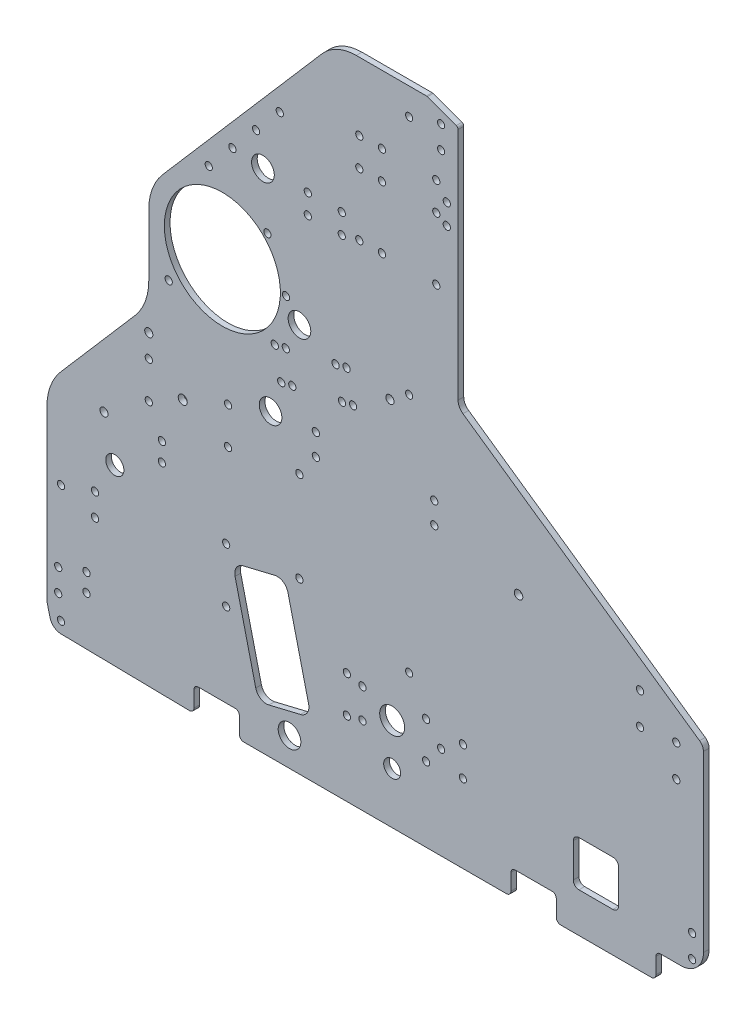
from build123d import *

# Parameters (mm, degrees)
SKETCH1_R           = 2.032
SKETCH1_R_2         = 5.08
SKETCH1_R_3         = 2.54
SKETCH1_R_4         = 6.35
SKETCH1_R_5         = 2
BOSS_EXTRUDE1_DEPTH = 3.175
FILLET1_R           = 2.286
FILLET2_R           = 6.35
SKETCH2_R           = 2.032
CUT_EXTRUDE1_DEPTH  = 505.524983177
FILLET3_R           = 1.5875
SKETCH3_R           = 6.35
SKETCH3_R_2         = 2.032
SKETCH3_R_3         = 2.286
CUT_EXTRUDE2_DEPTH  = 505.524983177
SKETCH4_R           = 2.032
SKETCH4_R_2         = 6.985
SKETCH4_R_3         = 4.7625
CUT_EXTRUDE3_DEPTH  = 505.524983177
SKETCH5_W           = 29.448186139
SKETCH5_H           = 14.946422423
SKETCH5_R           = 32.54375
SKETCH5_R_2         = 6.35
SKETCH5_R_3         = 2.39
CUT_EXTRUDE5_DEPTH  = 505.524983177
FILLET4_R           = 31.75
CUT_EXTRUDE6_DEPTH  = 505.524983177
FILLET5_R           = 25.4
SKETCH8_R           = 2.032000002
SKETCH8_R_2         = 2.031999999
SKETCH8_R_3         = 2.031999998
CUT_EXTRUDE7_DEPTH  = 505.524983177
SKETCH10_R          = 2.031999996
CUT_EXTRUDE8_DEPTH  = 505.524983177
SKETCH11_RX         = 2.032
SKETCH11_RY         = 2.031999502
CUT_EXTRUDE9_DEPTH  = 505.524983177
SKETCH12_R          = 2.032
CUT_EXTRUDE10_DEPTH = 505.524983319
SKETCH14_R          = 6.375981846
CUT_EXTRUDE11_DEPTH = 505.524983319
SKETCH15_R          = 2.286
CUT_EXTRUDE12_DEPTH = 505.524983319
FILLET6_R           = 12.7
FILLET7_R           = 5.08
FILLET8_R           = 2.54


with BuildPart() as part:
    # Sketch1 → Boss-Extrude1 (new body)
    with BuildSketch(Plane.XY):
        with BuildLine():
            Line((7.829508682, -19.049081656), (82.55, -20.32))
            Line((82.55, -20.32), (82.55, -6.35))
            Line((82.55, -6.35), (107.95, -6.35))
            Line((107.95, -6.35), (107.95, -20.32))
            Line((107.95, -20.32), (260.35, -20.32))
            Line((260.35, -20.32), (260.35, -6.35))
            Line((260.35, -6.35), (285.75, -6.35))
            Line((285.75, -6.35), (285.75, -20.32))
            Line((285.75, -20.32), (368.3, -20.32))
            Line((368.3, -20.32), (368.3, 106.68))
            Line((368.3, 106.68), (230.66375, 202.565))
            Line((230.66375, 202.565), (230.66375, 338.455))
            Line((230.66375, 338.455), (213.19998, 344.805))
            Line((213.19998, 344.805), (203.2, 344.805))
            Line((203.2, 344.805), (161.925, 344.805))
            Line((161.925, 344.805), (52.720122664, 218.469945827))
            ThreePointArc((52.720122664, 218.469945827), (52.803835479, 218.142145922), (52.832, 217.805))
            ThreePointArc((52.832, 217.805), (52.095493096, 216.239521914), (50.419872403, 215.808871996))
            Line((50.419872403, 215.808871996), (0, 157.48))
            Line((0, 157.48), (0, 0))
            Line((0, 0), (0, -6.35))
            ThreePointArc((0, -6.35), (0.047577015, -7.125863724), (0.189595124, -7.890101219))
            Line((0.189595124, -7.890101219), (1.777095124, -14.240101219))
            ThreePointArc((1.777095124, -14.240101219), (3.987212552, -17.671692778), (7.829508682, -19.049081656))
        make_face()
        with Locations((7.9375, -12.7)):
            Circle(SKETCH1_R, mode=Mode.SUBTRACT)
        with Locations((6.35, 0)):
            Circle(SKETCH1_R, mode=Mode.SUBTRACT)
        with Locations((6.35, 12.7)):
            Circle(SKETCH1_R, mode=Mode.SUBTRACT)
        with Locations((38.1, 78.105)):
            Circle(SKETCH1_R_2, mode=Mode.SUBTRACT)
        with Locations((57.15, 118.58625)):
            Circle(SKETCH1_R, mode=Mode.SUBTRACT)
        with Locations((57.15, 139.22375)):
            Circle(SKETCH1_R, mode=Mode.SUBTRACT)
        with Locations((76.2, 128.905)):
            Circle(SKETCH1_R_3, mode=Mode.SUBTRACT)
        with Locations((101.6, 118.58625)):
            Circle(SKETCH1_R, mode=Mode.SUBTRACT)
        with Locations((101.6, 139.22375)):
            Circle(SKETCH1_R, mode=Mode.SUBTRACT)
        with Locations((125.468192568, 147.91106164)):
            Circle(SKETCH1_R_4, mode=Mode.SUBTRACT)
        with Locations((203.2, 59.805)):
            Circle(SKETCH1_R_5, mode=Mode.SUBTRACT)
        with Locations((361.95, 0)):
            Circle(SKETCH1_R, mode=Mode.SUBTRACT)
        with Locations((361.95, 12.7)):
            Circle(SKETCH1_R, mode=Mode.SUBTRACT)
        with Locations((353.06, 82.955052336)):
            Circle(SKETCH1_R, mode=Mode.SUBTRACT)
        with Locations((332.74, 98.195052336)):
            Circle(SKETCH1_R, mode=Mode.SUBTRACT)
        with Locations((332.74, 115.975052336)):
            Circle(SKETCH1_R, mode=Mode.SUBTRACT)
        with Locations((353.06, 100.735052336)):
            Circle(SKETCH1_R, mode=Mode.SUBTRACT)
        with Locations((68.326, 182.923674932)):
            Circle(SKETCH1_R, mode=Mode.SUBTRACT)
        with Locations((76.2, 217.805)):
            Circle(SKETCH1_R, mode=Mode.SUBTRACT)
        with Locations((90.779500502, 249.682)):
            Circle(SKETCH1_R, mode=Mode.SUBTRACT)
        with Locations((104.067838673, 265.054783374)):
            Circle(SKETCH1_R, mode=Mode.SUBTRACT)
        with Locations((117.356176844, 280.427566748)):
            Circle(SKETCH1_R, mode=Mode.SUBTRACT)
        with Locations((130.644515014, 295.800350122)):
            Circle(SKETCH1_R, mode=Mode.SUBTRACT)
        with Locations((203.2, 194.805)):
            Circle(SKETCH1_R_5, mode=Mode.SUBTRACT)
        with Locations((224.31375, 287.401)):
            Circle(SKETCH1_R, mode=Mode.SUBTRACT)
        with Locations((224.31375, 298.831)):
            Circle(SKETCH1_R, mode=Mode.SUBTRACT)
        with Locations((203.2, 329.805)):
            Circle(SKETCH1_R_5, mode=Mode.SUBTRACT)
        with Locations((221.138115, 322.58)):
            Circle(SKETCH1_R_5, mode=Mode.SUBTRACT)
        with Locations((221.138115, 335.28)):
            Circle(SKETCH1_R_5, mode=Mode.SUBTRACT)
    extrude(amount=BOSS_EXTRUDE1_DEPTH)

    # Fillet1
    fillet1_edges = [part.edges().sort_by_distance(p)[0] for p in [
        (285.75, -6.35, 1.5875),
        (107.95, -6.35, 1.5875),
        (260.35, -6.35, 1.5875),
        (82.55, -6.35, 1.5875),
    ]]
    fillet(fillet1_edges, radius=FILLET1_R)

    # Fillet2
    fillet2_edges = [part.edges().sort_by_distance(p)[0] for p in [
        (230.66375, 202.565, 1.5875),
    ]]
    fillet(fillet2_edges, radius=FILLET2_R)

    # Sketch2 → Cut-Extrude1 (cut, through all)
    with BuildSketch(Plane(origin=(0, 0, 0), x_dir=(-1, 0, 0), z_dir=(0, 0, -1))):
        with Locations((-100.552770272, 71.086035298)):
            Circle(SKETCH2_R)
        with Locations((-100.552770272, 40.606035298)):
            Circle(SKETCH2_R)
        with Locations((-22.225, 18.202541089)):
            Circle(SKETCH2_R)
        with Locations((-22.225, 8.042541089)):
            Circle(SKETCH2_R)
    extrude(amount=-CUT_EXTRUDE1_DEPTH, mode=Mode.SUBTRACT)

    # Fillet3
    fillet3_edges = [part.edges().sort_by_distance(p)[0] for p in [
        (230.66375, 338.455, 1.5875),
        (213.19998, 344.805, 1.5875),
    ]]
    fillet(fillet3_edges, radius=FILLET3_R)

    # Sketch3 → Cut-Extrude2 (cut, through all)
    with BuildSketch(Plane.XY.offset(3.175)):
        with BuildLine():
            Line((127.789350211, 69.359774106), (110.090750339, 65.117184968))
            ThreePointArc((110.090750339, 65.117184968), (106.287939856, 62.356288953), (105.55119507, 57.715047577))
            Line((105.55119507, 57.715047577), (117.160037875, 9.287010566))
            ThreePointArc((117.160037875, 9.287010566), (119.92093389, 5.484200083), (124.562175266, 4.747455297))
            Line((124.562175266, 4.747455297), (142.260775137, 8.990044434))
            ThreePointArc((142.260775137, 8.990044434), (146.063585621, 11.75094045), (146.800330407, 16.392181825))
            Line((146.800330407, 16.392181825), (135.191487602, 64.820218836))
            ThreePointArc((135.191487602, 64.820218836), (132.430591586, 68.62302932), (127.789350211, 69.359774106))
        make_face()
        with Locations((136.094563167, -4.324155877)):
            Circle(SKETCH3_R)
        with Locations((26.987500002, 46.953113935)):
            Circle(SKETCH3_R_2)
        with Locations((26.987500002, 59.653113935)):
            Circle(SKETCH3_R_2)
        with Locations((7.937500002, 53.303113935)):
            Circle(SKETCH3_R_2)
        with Locations((32.030600738, 100.810868776)):
            Circle(SKETCH3_R_3)
        with Locations((64.525942114, 102.94048958)):
            Circle(SKETCH3_R_2)
        with Locations((64.525942114, 92.525786339)):
            Circle(SKETCH3_R_2)
        with Locations((134.14375, 208.228121768)):
            Circle(SKETCH3_R_2)
        with Locations((123.681970341, 233.485092108)):
            Circle(SKETCH3_R_2)
    extrude(amount=-CUT_EXTRUDE2_DEPTH, mode=Mode.SUBTRACT)

    # Sketch4 → Cut-Extrude3 (cut, through all)
    with BuildSketch(Plane.XY.offset(3.175)):
        with Locations((168.275, 42.06875)):
            Circle(SKETCH4_R)
        with Locations((212.725, 42.06875)):
            Circle(SKETCH4_R)
        with Locations((212.725, 21.43125)):
            Circle(SKETCH4_R)
        with Locations((168.275, 21.43125)):
            Circle(SKETCH4_R)
        with Locations((193.675, 31.75)):
            Circle(SKETCH4_R_2)
        with Locations((177.00498, 40.0431)):
            Circle(SKETCH4_R)
        with Locations((177.00498, 23.4569)):
            Circle(SKETCH4_R)
        with Locations((193.675, 8.466666658)):
            Circle(SKETCH4_R_3)
        with Locations((221.138115, 31.75)):
            Circle(SKETCH4_R)
        with Locations((233.36123, 23.4569)):
            Circle(SKETCH4_R)
        with Locations((233.36123, 40.0431)):
            Circle(SKETCH4_R)
    extrude(amount=-CUT_EXTRUDE3_DEPTH, mode=Mode.SUBTRACT)

    # Sketch5 → Cut-Extrude5 (cut, through all)
    with BuildSketch(Plane(origin=(0, 0, 0), x_dir=(-1, 0, 0), z_dir=(0, 0, -1))):
        Polygon((0, 157.48), (-57.15, 223.594705882), (-57.15, 165.333696112), (0, 99.218990229), align=None)
        with Locations((-356.354093068, -13.823211213)):
            Rectangle(SKETCH5_W, SKETCH5_H)
        with Locations((-98.425, 208.228121768)):
            Circle(SKETCH5_R)
        with Locations((-141.675587431, 197.971943782)):
            Circle(SKETCH5_R_2)
        with Locations((-264.573581764, 128.332790468)):
            Circle(SKETCH5_R_3)
    extrude(amount=-CUT_EXTRUDE5_DEPTH, mode=Mode.SUBTRACT)

    # Fillet4
    fillet4_edges = [part.edges().sort_by_distance(p)[0] for p in [
        (0, 99.218990229, 1.5875),
        (57.15, 165.333696112, 1.5875),
        (57.15, 223.594705882, 1.5875),
    ]]
    fillet(fillet4_edges, radius=FILLET4_R)

    # Sketch6 → Cut-Extrude6 (cut, through all)
    with BuildSketch(Plane.XY.offset(3.175)):
        with BuildLine():
            Line((298.45, 27.305), (317.5, 27.305))
            ThreePointArc((317.5, 27.305), (319.74506403, 26.37506403), (320.675, 24.13))
            Line((320.675, 24.13), (320.675, 5.08))
            ThreePointArc((320.675, 5.08), (319.74506403, 2.83493597), (317.5, 1.905))
            Line((317.5, 1.905), (298.45, 1.905))
            ThreePointArc((298.45, 1.905), (296.20493597, 2.83493597), (295.275, 5.08))
            Line((295.275, 5.08), (295.275, 24.13))
            ThreePointArc((295.275, 24.13), (296.20493597, 26.37506403), (298.45, 27.305))
        make_face()
    extrude(amount=-CUT_EXTRUDE6_DEPTH, mode=Mode.SUBTRACT)

    # Fillet5
    fillet5_edges = [part.edges().sort_by_distance(p)[0] for p in [
        (161.925, 344.805, 1.5875),
    ]]
    fillet(fillet5_edges, radius=FILLET5_R)

    # Sketch8 → Cut-Extrude7 (cut, through all)
    with BuildSketch(Plane(origin=(0, 0, 0), x_dir=(-1, 0, 0), z_dir=(0, 0, -1))):
        with Locations((-218.44, 290.83)):
            Circle(SKETCH8_R)
        with Locations((-187.96, 290.83)):
            Circle(SKETCH8_R)
        with Locations((-187.96, 306.70500001)):
            Circle(SKETCH8_R_2)
        with Locations((-175.26, 290.83)):
            Circle(SKETCH8_R)
        with Locations((-187.96, 255.905)):
            Circle(SKETCH8_R)
        with Locations((-218.44, 306.70500001)):
            Circle(SKETCH8_R_3)
        with Locations((-175.26, 306.70500001)):
            Circle(SKETCH8_R_2)
        with Locations((-175.26, 255.905)):
            Circle(SKETCH8_R)
        with Locations((-218.44, 255.905)):
            Circle(SKETCH8_R)
    extrude(amount=-CUT_EXTRUDE7_DEPTH, mode=Mode.SUBTRACT)

    # Sketch10 → Cut-Extrude8 (cut, through all)
    with BuildSketch(Plane.XY.offset(3.175)):
        with Locations((141.642480004, 74.684371768)):
            Circle(SKETCH10_R)
        with Locations((141.642480004, 125.484371768)):
            Circle(SKETCH10_R)
    extrude(amount=-CUT_EXTRUDE8_DEPTH, mode=Mode.SUBTRACT)

    # Sketch11 → Cut-Extrude9 (cut, through all)
    with BuildSketch(Plane.XY.offset(3.175)):
        with Locations(Location((150.881424454, 138.43), (0, 0, 90))):
            Ellipse(SKETCH11_RX, SKETCH11_RY)
        with Locations(Location((150.881424454, 150.495), (0, 0, 90))):
            Ellipse(SKETCH11_RX, SKETCH11_RY)
        with Locations(Location((217.30240818, 150.495), (0, 0, 90))):
            Ellipse(SKETCH11_RX, SKETCH11_RY)
        with Locations(Location((217.30240818, 138.43), (0, 0, 90))):
            Ellipse(SKETCH11_RX, SKETCH11_RY)
    extrude(amount=-CUT_EXTRUDE9_DEPTH, mode=Mode.SUBTRACT)

    # Sketch12 → Cut-Extrude10 (cut, through all)
    with BuildSketch(Plane(origin=(0, 0, 0), x_dir=(-1, 0, 0), z_dir=(0, 0, -1))):
        with Locations((-165.4175, 264.63498)):
            Circle(SKETCH12_R)
        with Locations((-165.4175, 253.52248)):
            Circle(SKETCH12_R)
        with Locations((-146.3675, 253.52248)):
            Circle(SKETCH12_R)
        with Locations((-146.3675, 264.63498)):
            Circle(SKETCH12_R)
    extrude(amount=-CUT_EXTRUDE10_DEPTH, mode=Mode.SUBTRACT)

    # Sketch14 → Cut-Extrude11 (cut, through all)
    with BuildSketch(Plane(origin=(0, 0, 0), x_dir=(-1, 0, 0), z_dir=(0, 0, -1))):
        with Locations((-121.184716432, 263.688494682)):
            Circle(SKETCH14_R)
    extrude(amount=-CUT_EXTRUDE11_DEPTH, mode=Mode.SUBTRACT)

    # Sketch15 → Cut-Extrude12 (cut, through all)
    with BuildSketch(Plane.XY.offset(3.175)):
        with Locations((57.15, 151.92375)):
            Circle(SKETCH15_R)
        with Locations((192.439038956, 187.119947783)):
            Circle(SKETCH15_R)
        with BuildLine():
            ThreePointArc((163.873739892, 173.680575348), (163.573171662, 172.102507308), (164.512499361, 170.799317578))
            ThreePointArc((164.512499361, 170.799317578), (167.540838635, 172.982117899), (163.873739892, 173.680575348))
        make_face()
        with BuildLine():
            ThreePointArc((173.43975005, 172.778441408), (173.74031828, 174.356509448), (172.800990581, 175.659699178))
            ThreePointArc((172.800990581, 175.659699178), (169.772651307, 173.476898857), (173.43975005, 172.778441408))
        make_face()
        with BuildLine():
            ThreePointArc((169.158852977, 192.088320238), (166.130513704, 189.905519916), (169.797612447, 189.207062467))
            ThreePointArc((169.797612447, 189.207062467), (170.098180676, 190.785130507), (169.158852977, 192.088320238))
        make_face()
        with BuildLine():
            ThreePointArc((160.231602288, 190.109196408), (159.931034058, 188.531128368), (160.870361758, 187.227938637))
            ThreePointArc((160.870361758, 187.227938637), (163.898701031, 189.410738959), (160.231602288, 190.109196408))
        make_face()
        with BuildLine():
            ThreePointArc((129.776601843, 166.121421831), (129.476033613, 164.543353791), (130.415361312, 163.240164061))
            ThreePointArc((130.415361312, 163.240164061), (133.443700586, 165.422964382), (129.776601843, 166.121421831))
        make_face()
        with BuildLine():
            ThreePointArc((139.342612002, 165.219287891), (139.643180231, 166.797355931), (138.703852532, 168.100545661))
            ThreePointArc((138.703852532, 168.100545661), (135.675513258, 165.91774534), (139.342612002, 165.219287891))
        make_face()
        with BuildLine():
            ThreePointArc((135.700474398, 181.647908951), (136.001042628, 183.225976991), (135.061714929, 184.529166721))
            ThreePointArc((135.061714929, 184.529166721), (132.033375655, 182.3463664), (135.700474398, 181.647908951))
        make_face()
        with BuildLine():
            ThreePointArc((126.134464239, 182.550042891), (125.83389601, 180.971974851), (126.773223709, 179.668785121))
            ThreePointArc((126.773223709, 179.668785121), (129.801562983, 181.851585442), (126.134464239, 182.550042891))
        make_face()
    extrude(amount=-CUT_EXTRUDE12_DEPTH, mode=Mode.SUBTRACT)

    # Fillet6
    fillet6_edges = [part.edges().sort_by_distance(p)[0] for p in [
        (368.3, -6.350000001, 1.5875),
    ]]
    fillet(fillet6_edges, radius=FILLET6_R)

    # Fillet7
    fillet7_edges = [part.edges().sort_by_distance(p)[0] for p in [
        (368.3, 106.68, 1.5875),
    ]]
    fillet(fillet7_edges, radius=FILLET7_R)

    # Fillet8
    fillet8_edges = [part.edges().sort_by_distance(p)[0] for p in [
        (82.55, -20.32, 1.5875),
        (107.95, -20.32, 1.5875),
        (260.35, -20.32, 1.5875),
        (285.75, -20.32, 1.5875),
        (341.629999999, -20.32, 1.5875),
        (341.629999999, -6.350000001, 1.5875),
    ]]
    fillet(fillet8_edges, radius=FILLET8_R)


solid = part.part
